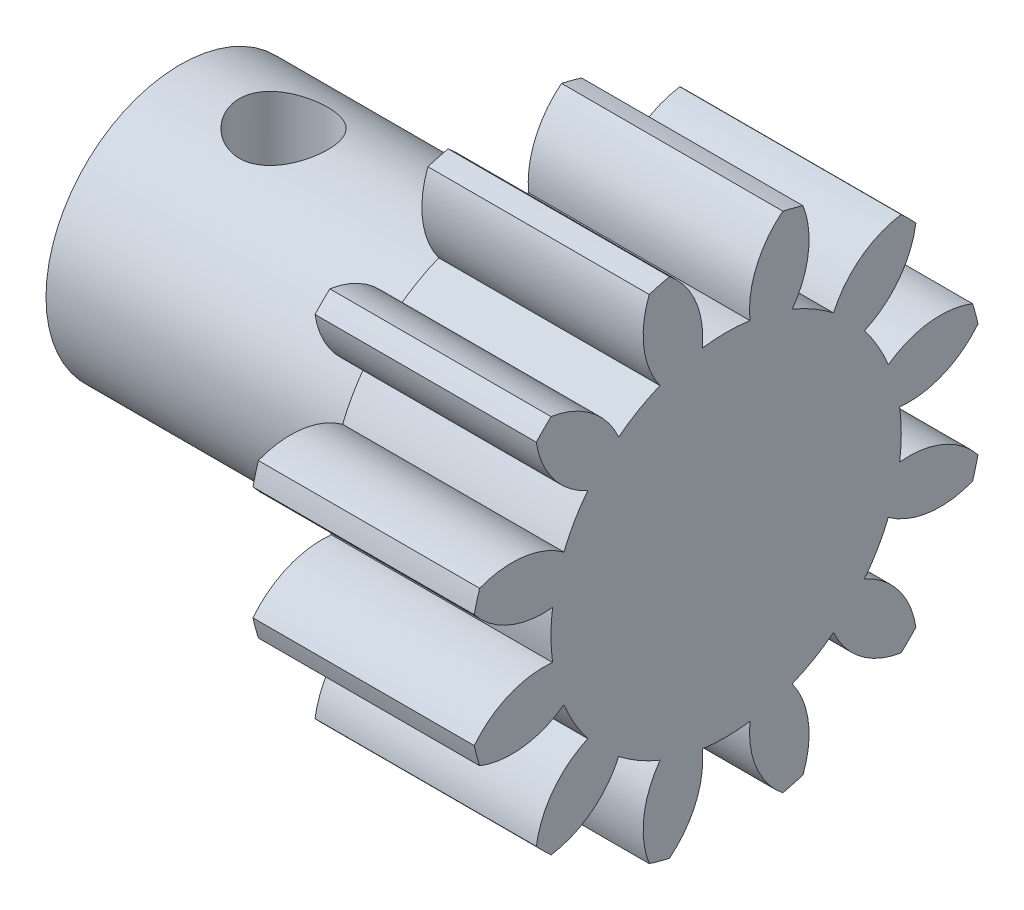
from build123d import *

# Parameters (mm, degrees)
BASPROSKE_W         = 9.525
BASPROSKE_H         = 11.1125
TOOTHCUT_DEPTH      = 19.376641083
TEETHCUTS_COUNT     = 12
BORSKE_R            = 3.175
BORE_DEPTH          = 9.525
BOSS_EXTRUDE1_START = -25.4
SKETCH2_R           = 7.539355
BOSS_EXTRUDE1_DEPTH = 25.4
CUT_EXTRUDE1_DEPTH  = 23.495
SKETCH5_R           = 1.905
CUT_EXTRUDE2_DEPTH  = 24.605363577
SKETCH6_R           = 12.7
SKETCH6_R_2         = 5.7785
CUT_EXTRUDE3_DEPTH  = 15.875
SKETCH7_R           = 5.7785
CUT_EXTRUDE5_DEPTH  = 1.905
FILLET1_R           = 1.058333333


with BuildPart() as part:
    # BasProSke → Base-Revolve (revolve)
    with BuildSketch(Plane(origin=(0, 0, 0), x_dir=(1, 0, 0), z_dir=(0, 1, 0)), mode=Mode.PRIVATE) as base_revolve_sk:
        with Locations((4.7625, 5.55625)):
            Rectangle(BASPROSKE_W, BASPROSKE_H)
    revolve(base_revolve_sk.sketch.rotate(Axis((-10, 0, 0), (1, 0, 0)), 180), axis=Axis((-10, 0, 0), (1, 0, 0)))

    # TooCutSke → ToothCut (cut, through all)
    with BuildSketch(Plane(origin=(0, 0, 0), x_dir=(0, 0, -1), z_dir=(1, 0, 0))):
        with BuildLine():
            ThreePointArc((1.026937745, 7.469087808), (0, 7.539355), (-1.026937745, 7.469087808))
            ThreePointArc((-1.026937745, 7.469087808), (-1.30857978, 9.35080814), (-2.465050847, 10.861691431))
            ThreePointArc((-2.465050847, 10.861691431), (0, 11.1379), (2.465050847, 10.861691431))
            ThreePointArc((2.465050847, 10.861691431), (1.30857978, 9.35080814), (1.026937745, 7.469087808))
        make_face()
    toothcut = extrude(amount=TOOTHCUT_DEPTH, mode=Mode.SUBTRACT)

    # TeethCuts: ToothCut ×12 about axis
    teethcuts_axis = Axis((0, 0, 0), (1, 0, 0))
    for i in range(1, TEETHCUTS_COUNT):
        add(toothcut.rotate(teethcuts_axis, i * 360 / TEETHCUTS_COUNT), mode=Mode.SUBTRACT)

    # BorSke → Bore (cut, symmetric)
    with BuildSketch(Plane(origin=(0, 0, 0), x_dir=(0, 0, -1), z_dir=(1, 0, 0))):
        with Locations(Location((0, 0, 0), (0, 0, 180))):
            Circle(BORSKE_R)
    extrude(amount=BORE_DEPTH, both=True, mode=Mode.SUBTRACT)

    # Sketch2 → Boss-Extrude1 (add)
    with BuildSketch(Plane(origin=(9.525, 0, 0), x_dir=(0, 0, -1), z_dir=(1, 0, 0)).offset(BOSS_EXTRUDE1_START)):
        with Locations(Location((0, 0, 0), (0, 0, 172.171388978))):
            Circle(SKETCH2_R)
    extrude(amount=BOSS_EXTRUDE1_DEPTH)

    # Sketch3 → Cut-Extrude1 (cut)
    with BuildSketch(Plane.ZY.offset(15.875)):
        with BuildLine():
            Line((-1.778, 2.8575), (1.778, 2.8575))
            ThreePointArc((1.778, 2.8575), (0, -3.3655), (-1.778, 2.8575))
        make_face()
    extrude(amount=-CUT_EXTRUDE1_DEPTH, mode=Mode.SUBTRACT)

    # Sketch5 → Cut-Extrude2 (cut, through all)
    with BuildSketch(Plane.XZ.offset(-2.8575)):
        with Locations(Location((-9.525, 0, 0), (0, 0, 270))):
            Circle(SKETCH5_R)
    extrude(amount=-CUT_EXTRUDE2_DEPTH, mode=Mode.SUBTRACT)

    # Sketch6 → Cut-Extrude3 (cut)
    with BuildSketch(Plane.ZY.offset(15.875)):
        Circle(SKETCH6_R)
        Circle(SKETCH6_R_2, mode=Mode.SUBTRACT)
    extrude(amount=-CUT_EXTRUDE3_DEPTH, mode=Mode.SUBTRACT)

    # Sketch7 → Cut-Extrude5 (cut)
    with BuildSketch(Plane.ZY.offset(15.875)):
        Circle(SKETCH7_R)
    extrude(amount=-CUT_EXTRUDE5_DEPTH, mode=Mode.SUBTRACT)

    # Fillet1
    # the kernel refuses this fillet: 1.058333333 mm, written as the material it adds along each edge
    with BuildSketch(Plane(origin=(7.62, 0, 0), x_dir=(0, 0.9999950652018581, 0.0031415874858805883), z_dir=(0, 0.0031415874858805883, -0.9999950652018581))) as fillet1_piece_1:
        with BuildLine():
            CenterArc((3.3655 - FILLET1_R, -FILLET1_R), FILLET1_R, 0, 90)
            Line((3.3655 - FILLET1_R, 0), (3.3655, 0))
            Line((3.3655, 0), (3.3655, -FILLET1_R))
        make_face()
    revolve(axis=Axis((7.62, 0, 0), (1, 0, 0)), revolution_arc=359.64)
    with BuildSketch(Plane(origin=(7.62, 2.8575, -4.423833333), x_dir=(-1, 0, 0), z_dir=(0, 0, 1))) as fillet1_piece_2:
        with BuildLine():
            CenterArc((FILLET1_R, FILLET1_R), FILLET1_R, 180, 90)
            Line((0, FILLET1_R), (0, 0))
            Line((0, 0), (FILLET1_R, 0))
        make_face()
    extrude(amount=8.847666667)


solid = part.part
